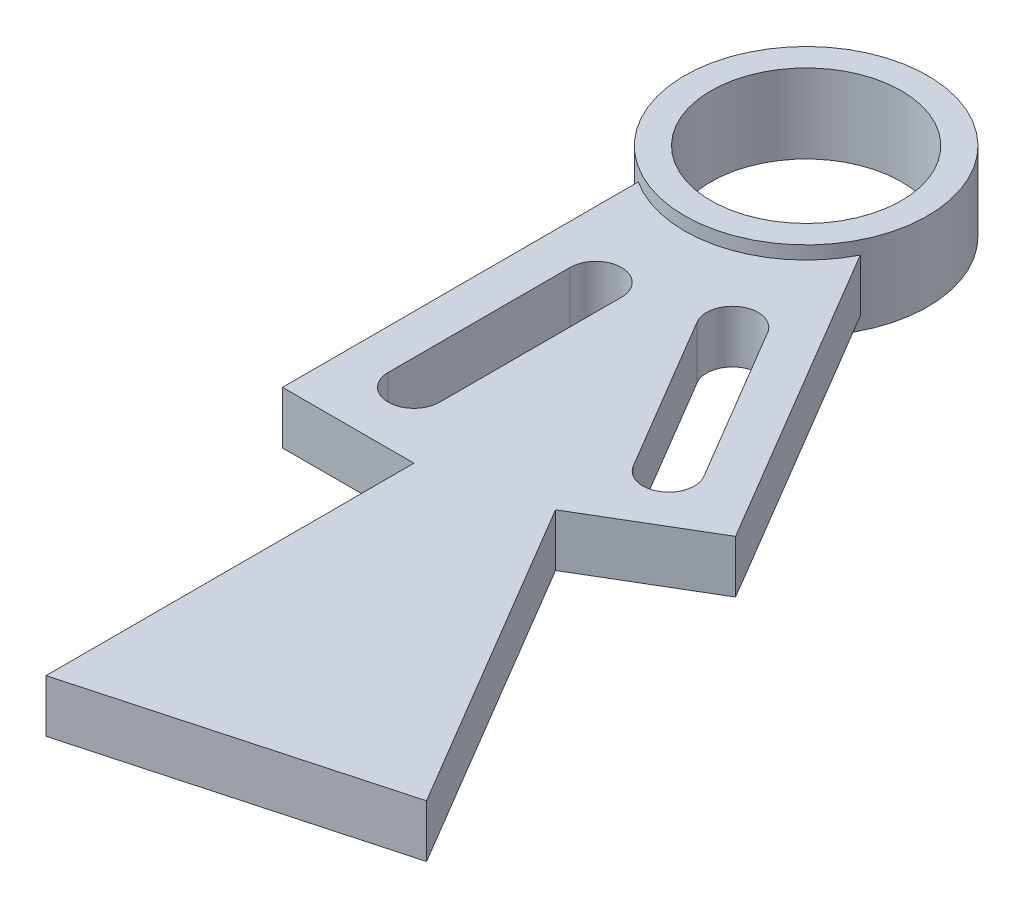
from build123d import *

# Parameters (mm, degrees)
SKETCH1_R             = 11.5062
BEARING_EXTRUDE_DEPTH = 4.7625
BOSS_EXTRUDE2_DEPTH   = 3.175


with BuildPart() as part:
    # Sketch1 → Bearing extrude (new, symmetric)
    with BuildSketch(Plane(origin=(0, 0, 0), x_dir=(1, 0, 0), z_dir=(0, 1, 0))):
        with BuildLine():
            ThreePointArc((14.6812, 0), (-7.035822924, 12.885450292), (-7.9375, -12.350454534))
            ThreePointArc((-7.9375, -12.350454534), (3.879289041, -14.159405001), (13.123977088, -6.580186838))
            ThreePointArc((13.123977088, -6.580186838), (14.286591019, -3.380968871), (14.6812, 0))
        make_face()
        Circle(SKETCH1_R, mode=Mode.SUBTRACT)
    extrude(amount=BEARING_EXTRUDE_DEPTH, both=True)

    # Sketch1<5> → Boss-Extrude2 (add, symmetric)
    with BuildSketch(Plane(origin=(0, 0, 0), x_dir=(1, 0, 0), z_dir=(0, 1, 0))):
        with BuildLine():
            Line((-7.9375, -12.350454534), (-7.9375, -55.3212))
            Line((-7.9375, -55.3212), (7.9375, -55.3212))
            Line((7.9375, -55.3212), (7.9375, -99.7712))
            Line((7.9375, -99.7712), (44.023034823, -89.884752103))
            Line((44.023034823, -89.884752103), (21.367423023, -51.641769035))
            Line((21.367423023, -51.641769035), (28.196527143, -47.596124071))
            Line((28.196527143, -47.596124071), (35.025631262, -43.550479106))
            Line((35.025631262, -43.550479106), (13.123977088, -6.580186838))
            ThreePointArc((13.123977088, -6.580186838), (3.879289041, -14.159405001), (-7.9375, -12.350454534))
        make_face()
        with BuildLine():
            ThreePointArc((3.1115, -47.3837), (0, -50.4952), (-3.1115, -47.3837))
            Line((-3.1115, -47.3837), (-3.1115, -25.4127))
            ThreePointArc((-3.1115, -25.4127), (0, -22.3012), (3.1115, -25.4127))
            Line((3.1115, -25.4127), (3.1115, -47.3837))
        make_face(mode=Mode.SUBTRACT)
        with BuildLine():
            ThreePointArc((26.827890993, -39.181127125), (27.165208836, -41.538555466), (25.736775004, -43.444028766))
            ThreePointArc((25.736775004, -43.444028766), (23.379346664, -43.781346609), (21.473873364, -42.352912777))
            Line((21.473873364, -42.352912777), (10.275528103, -23.449952575))
            ThreePointArc((10.275528103, -23.449952575), (11.366644091, -19.187050934), (15.629545732, -20.278166923))
            Line((15.629545732, -20.278166923), (26.827890993, -39.181127125))
        make_face(mode=Mode.SUBTRACT)
    extrude(amount=BOSS_EXTRUDE2_DEPTH, both=True)


solid = part.part
